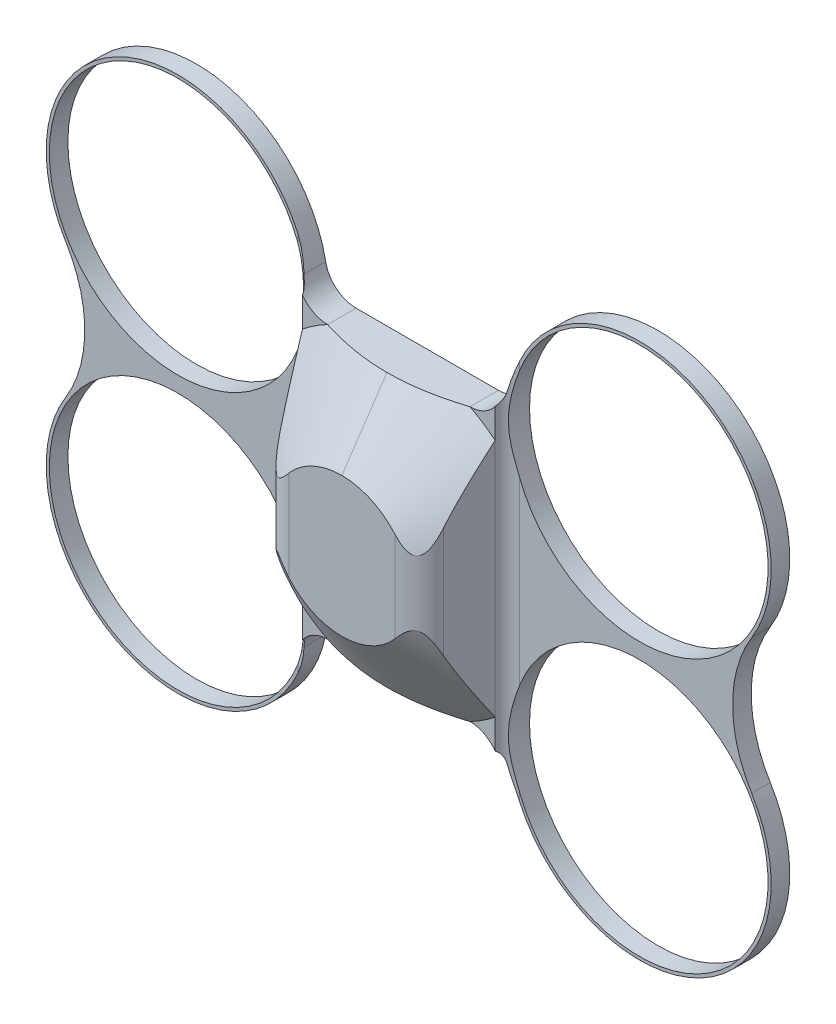
from build123d import *

# Parameters (mm, degrees)
BOSS_EXTRUDE1_DEPTH     = 27.56
CUT_EXTRUDE1_DEPTH      = 149.090525018
CUT_EXTRUDE1_DEPTH_BACK = 149.090525018
CUT_EXTRUDE2_DEPTH      = 149.090525174
CUT_EXTRUDE2_DEPTH_BACK = 149.090525174
SKETCH3_R               = 41.5


with BuildPart() as part:
    # Sketch1 → Boss-Extrude1 (new body)
    with BuildSketch(Plane.XY):
        with BuildLine():
            Line((22.96117968, 44), (-22.96117968, 44))
            ThreePointArc((-22.96117968, 44), (-29.323269783, 46.284832502), (-32.778097836, 52.095238095))
            ThreePointArc((-32.778097836, 52.095238095), (-89.927364847, 83.601091069), (-110.70300535, 21.738095238))
            ThreePointArc((-110.70300535, 21.738095238), (-104.55417528, 0), (-110.70300535, -21.738095238))
            ThreePointArc((-110.70300535, -21.738095238), (-89.927364847, -83.601091069), (-32.778097836, -52.095238095))
            ThreePointArc((-32.778097836, -52.095238095), (-29.323269783, -46.284832502), (-22.96117968, -44))
            Line((-22.96117968, -44), (22.96117968, -44))
            ThreePointArc((22.96117968, -44), (29.323269783, -46.284832502), (32.778097836, -52.095238095))
            ThreePointArc((32.778097836, -52.095238095), (89.927364847, -83.601091069), (110.70300535, -21.738095238))
            ThreePointArc((110.70300535, -21.738095238), (104.55417528, 0), (110.70300535, 21.738095238))
            ThreePointArc((110.70300535, 21.738095238), (89.927364847, 83.601091069), (32.778097836, 52.095238095))
            ThreePointArc((32.778097836, 52.095238095), (29.323269783, 46.284832502), (22.96117968, 44))
        make_face()
    extrude(amount=BOSS_EXTRUDE1_DEPTH)

    # Sketch2 → Cut-Extrude1 (cut, two sides: drawn at the far end of the back side and taken through both)
    with BuildSketch(Plane(origin=(0, 0, 0), x_dir=(1, 0, 0), z_dir=(0, 1, 0)).offset(-CUT_EXTRUDE1_DEPTH_BACK)):
        with BuildLine():
            Line((117, -6), (35.767564174, -6))
            ThreePointArc((35.767564174, -6), (32.945610035, -6.872461407), (31.108474327, -9.185370066))
            Line((31.108474327, -9.185370066), (26.433179694, -21.189259868))
            ThreePointArc((26.433179694, -21.189259868), (22.758908279, -25.815077185), (17.115, -27.56))
            Line((17.115, -27.56), (117, -27.56))
            Line((117, -27.56), (117, -6))
        make_face()
        with BuildLine():
            Line((-117, -27.56), (-117, -6))
            Line((-117, -6), (-35.767564174, -6))
            ThreePointArc((-35.767564174, -6), (-32.945610035, -6.872461407), (-31.108474327, -9.185370066))
            Line((-31.108474327, -9.185370066), (-26.433179694, -21.189259868))
            ThreePointArc((-26.433179694, -21.189259868), (-22.758908279, -25.815077185), (-17.115, -27.56))
            Line((-17.115, -27.56), (-117, -27.56))
        make_face()
    extrude(amount=CUT_EXTRUDE1_DEPTH + CUT_EXTRUDE1_DEPTH_BACK, mode=Mode.SUBTRACT)

    # Sketch3 → Cut-Extrude2 (cut, two sides: drawn at the far end of the back side and taken through both)
    with BuildSketch(Plane(origin=(0, 0, 0), x_dir=(-1, 0, 0), z_dir=(0, 0, -1)).offset(-CUT_EXTRUDE2_DEPTH_BACK)):
        with Locations((74.5, 44)):
            Circle(SKETCH3_R)
        with Locations((-74.5, 44)):
            Circle(SKETCH3_R)
        with Locations((74.5, -44)):
            Circle(SKETCH3_R)
        with Locations((-74.5, -44)):
            Circle(SKETCH3_R)
    extrude(amount=CUT_EXTRUDE2_DEPTH + CUT_EXTRUDE2_DEPTH_BACK, mode=Mode.SUBTRACT)

    # Cut-Sweep1: sweep along a path in Sketch4
    with BuildLine(Plane.XY.offset(27.56)) as cut_sweep1_path:
        CenterArc((0, 0), 22.5, 0, 360)
    # Sketch5 → Cut-Sweep1 (sweep, cut)
    with BuildSketch(Plane(origin=(0, 0, 0), x_dir=(0, 0, -1), z_dir=(1, 0, 0))):
        Polygon((-27.56, 22.5), (-9.185370066, 49.639215001), (-9.185370066, 86.5), (-27.56, 86.5), (-27.56, 48.201587292), align=None)
    sweep(path=cut_sweep1_path.line, mode=Mode.SUBTRACT)


solid = part.part
